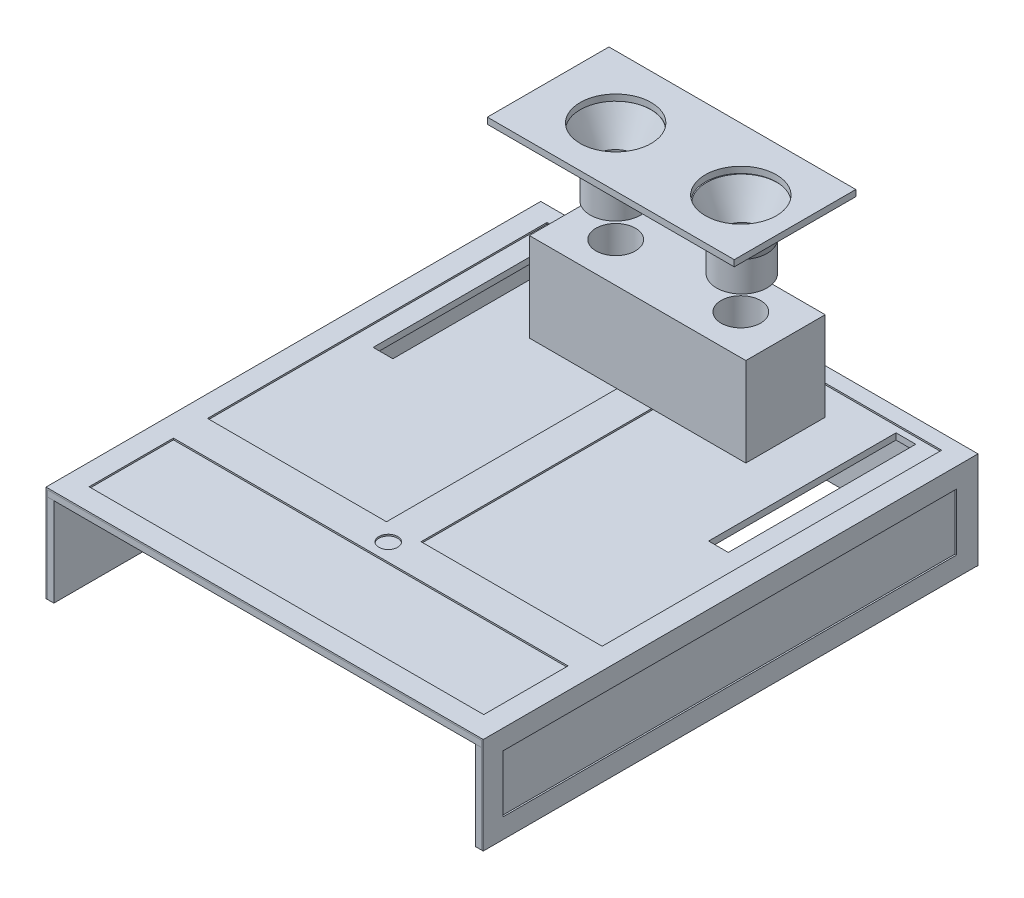
from build123d import *

# Parameters (mm, degrees)
SKETCH2_W            = 10
SKETCH2_H            = 95
BOSS_EXTRUDE1_DEPTH  = 3.175
BOSS_EXTRUDE2_DEPTH  = 3.175
SKETCH6_W            = 220
SKETCH6_H            = 250
SKETCH6_R            = 4.757017435
SKETCH6_W_2          = 200
SKETCH6_H_2          = 42.736820738
SKETCH6_W_3          = 90.723680888
SKETCH6_H_3          = 172.072273937
SKETCH6_W_4          = 91.778190592
BOSS_EXTRUDE5_DEPTH  = 0.8
SKETCH9_W            = 249.946143141
SKETCH9_H            = 48.975
SKETCH9_W_2          = 229.946143141
SKETCH9_H_2          = 28.975
BOSS_EXTRUDE7_DEPTH  = 0.8
SKETCH10_W           = 109.697281068
SKETCH10_H           = 40.228121307
BOSS_EXTRUDE8_DEPTH  = 45
SKETCH11_R           = 10
CUT_EXTRUDE1_DEPTH   = 30
SKETCH12_R           = 3.414901982
BOSS_EXTRUDE9_DEPTH  = 93
SKETCH13_W           = 125.125550564
SKETCH13_H           = 61.612798217
SKETCH13_R           = 18
BOSS_EXTRUDE10_DEPTH = 3.175
SKETCH16_R           = 12.813177074
SKETCH16_R_2         = 10.264351108
BOSS_EXTRUDE11_DEPTH = 15.175
SKETCH17_W           = 221.6
SKETCH17_H           = 49.134485582
BOSS_EXTRUDE12_DEPTH = 0.8


with BuildPart() as part:
    # Sketch2 → Boss-Extrude1 (new body)
    with BuildSketch(Plane(origin=(0, 0, 0), x_dir=(1, 0, 0), z_dir=(0, 1, 0))):
        Polygon((-162.266187111, -88.214102909), (57.733812889, -88.214102909), (57.733812889, -68.214102909), (54.558812889, -68.214102909), (54.558812889, -48.214102909), (57.733812889, -48.214102909), (57.733812889, -28.214102909), (54.558812889, -28.214102909), (54.558812889, -8.214102909), (57.733812889, -8.214102909), (57.733812889, 11.785897091), (54.558812889, 11.785897091), (54.558812889, 31.785897091), (57.733812889, 31.785897091), (57.733812889, 51.785897091), (54.558812889, 51.785897091), (54.558812889, 71.785897091), (57.733812889, 71.785897091), (57.733812889, 91.785897091), (54.558812889, 91.785897091), (54.558812889, 111.785897091), (57.733812889, 111.785897091), (57.733812889, 131.785897091), (54.558812889, 131.785897091), (54.558812889, 151.785897091), (57.733812889, 151.785897091), (57.733812889, 161.785897091), (-162.266187111, 161.785897091), (-162.266187111, 151.785897091), (-159.091187111, 151.785897091), (-159.091187111, 131.785897091), (-162.266187111, 131.785897091), (-162.266187111, 111.785897091), (-159.091187111, 111.785897091), (-159.091187111, 91.785897091), (-162.266187111, 91.785897091), (-162.266187111, 71.785897091), (-159.091187111, 71.785897091), (-159.091187111, 51.785897091), (-162.266187111, 51.785897091), (-162.266187111, 31.785897091), (-159.091187111, 31.785897091), (-159.091187111, 11.785897091), (-162.266187111, 11.785897091), (-162.266187111, -8.214102909), (-159.091187111, -8.214102909), (-159.091187111, -28.214102909), (-162.266187111, -28.214102909), (-162.266187111, -48.214102909), (-159.091187111, -48.214102909), (-159.091187111, -68.214102909), (-162.266187111, -68.214102909), align=None)
        with Locations((32.733812889, 104.285897091)):
            Rectangle(SKETCH2_W, SKETCH2_H, mode=Mode.SUBTRACT)
        with Locations((-137.266187111, 104.285897091)):
            Rectangle(SKETCH2_W, SKETCH2_H, mode=Mode.SUBTRACT)
    extrude(amount=BOSS_EXTRUDE1_DEPTH)


with BuildPart() as body_2:
    # Sketch3 → Boss-Extrude2 (new body)
    with BuildSketch(Plane.ZY.offset(159.091187111)):
        Polygon((68.214102909, 3.175), (68.214102909, 0), (88.214102909, 0), (88.214102909, -45), (-161.732040232, -45), (-161.732040232, 0), (-151.785897091, 0), (-151.785897091, 3.175), (-131.785897091, 3.175), (-131.785897091, 0), (-111.785897091, 0), (-111.785897091, 3.175), (-91.785897091, 3.175), (-91.785897091, 0), (-71.785897091, 0), (-71.785897091, 3.175), (-51.785897091, 3.175), (-51.785897091, 0), (-31.785897091, 0), (-31.785897091, 3.175), (-11.785897091, 3.175), (-11.785897091, 0), (8.214102909, 0), (8.214102909, 3.175), (28.214102909, 3.175), (28.214102909, 0), (48.214102909, 0), (48.214102909, 3.175), align=None)
    extrude(amount=BOSS_EXTRUDE2_DEPTH)


with BuildPart() as body_3:
    # Sketch6 → Boss-Extrude5 (new body)
    with BuildSketch(Plane(origin=(0, 3.175, 0), x_dir=(1, 0, 0), z_dir=(0, 1, 0))):
        with Locations((-52.266187111, 36.785897091)):
            Rectangle(SKETCH6_W, SKETCH6_H)
        with Locations((-52.266187111, -25.538376938)):
            Circle(SKETCH6_R, mode=Mode.SUBTRACT)
        with Locations((-52.266187111, -55.794020292)):
            Rectangle(SKETCH6_W_2, SKETCH6_H_2, mode=Mode.SUBTRACT)
        with Locations((-106.904346667, 68.87270147)):
            Rectangle(SKETCH6_W_3, SKETCH6_H_3, mode=Mode.SUBTRACT)
        with Locations((1.844717593, 68.87270147)):
            Rectangle(SKETCH6_W_4, SKETCH6_H_3, mode=Mode.SUBTRACT)
    extrude(amount=BOSS_EXTRUDE5_DEPTH)

    # Sketch9 → Boss-Extrude7 (add)
    with BuildSketch(Plane.ZY.offset(162.266187111)):
        with Locations((-36.758968661, -20.5125)):
            Rectangle(SKETCH9_W, SKETCH9_H)
        with Locations((-36.758968661, -20.5125)):
            Rectangle(SKETCH9_W_2, SKETCH9_H_2, mode=Mode.SUBTRACT)
    boss_extrude7 = extrude(amount=BOSS_EXTRUDE7_DEPTH)

    # Mirror5: Boss-Extrude7 across plane
    add(boss_extrude7.mirror(Plane.ZY.offset(52.266187111)))

    # Sketch17 → Boss-Extrude12 (add)
    with BuildSketch(Plane(origin=(0, 0, -161.732040232), x_dir=(-1, 0, 0), z_dir=(0, 0, -1))):
        with Locations((52.266187111, -20.592242791)):
            Rectangle(SKETCH17_W, SKETCH17_H)
    extrude(amount=BOSS_EXTRUDE12_DEPTH)


with BuildPart() as body_4:
    # Sketch10 → Boss-Extrude8 (new body)
    with BuildSketch(Plane(origin=(0, 3.975, 0), x_dir=(1, 0, 0), z_dir=(0, 1, 0))):
        with Locations((-51.104751529, 119.775749139)):
            Rectangle(SKETCH10_W, SKETCH10_H)
    extrude(amount=BOSS_EXTRUDE8_DEPTH)

    # Sketch11 → Cut-Extrude1 (cut)
    with BuildSketch(Plane(origin=(0, 48.975, 0), x_dir=(1, 0, 0), z_dir=(0, 1, 0))):
        with Locations((-82.332653929, 119.775749139)):
            Circle(SKETCH11_R)
        with Locations((-18.909790917, 119.775749139)):
            Circle(SKETCH11_R)
    extrude(amount=-CUT_EXTRUDE1_DEPTH, mode=Mode.SUBTRACT)


with BuildPart() as body_5:
    # Sketch12 → Boss-Extrude9 (new body)
    with BuildSketch(Plane(origin=(0, 3.975, 0), x_dir=(1, 0, 0), z_dir=(0, 1, 0))):
        with Locations((-113.317828916, 147.399324115)):
            Circle(SKETCH12_R)
    extrude(amount=BOSS_EXTRUDE9_DEPTH)

    # Sketch13 → Boss-Extrude10 (add)
    with BuildSketch(Plane(origin=(0, 96.975, 0), x_dir=(1, 0, 0), z_dir=(0, 1, 0))):
        with Locations((-54.859424633, 120.633304207)):
            Rectangle(SKETCH13_W, SKETCH13_H)
        with Locations((-82.332653929, 119.775749139)):
            Circle(SKETCH13_R, mode=Mode.SUBTRACT)
        with Locations((-18.909790917, 119.775749139)):
            Circle(SKETCH13_R, mode=Mode.SUBTRACT)
    extrude(amount=BOSS_EXTRUDE10_DEPTH)

    # Sketch14 → Revolve1 (revolve)
    with BuildSketch(Plane(origin=(-82.422199915, 0, 0), x_dir=(0, 0, -1), z_dir=(1, 0, 0))):
        Polygon((101.834041847, 96.975), (109.625498003, 81.251522407), (106.962572065, 81.251522407), (99.342946609, 96.975), align=None)
    revolve1 = revolve(axis=Axis((-82.422199915, 48.975, -119.775749139), (0, 1, 0)))

    # Sketch16 → Boss-Extrude11 (add)
    with BuildSketch(Plane.XZ.offset(-81.251522407)):
        with Locations((-82.422199915, -119.775749139)):
            Circle(SKETCH16_R)
        with Locations((-82.422199915, -119.775749139)):
            Circle(SKETCH16_R_2, mode=Mode.SUBTRACT)
    boss_extrude11 = extrude(amount=BOSS_EXTRUDE11_DEPTH)

    # Mirror2: Revolve1, Boss-Extrude11 across plane
    add(revolve1.mirror(Plane.ZY.offset(50.422199915)))
    add(boss_extrude11.mirror(Plane.ZY.offset(50.422199915)))


with BuildPart() as body_6:
    # Mirror4: mirrored copy
    add(body_2.part.mirror(Plane.ZY.offset(52.266187111)))


solid = Compound([part.part, body_2.part, body_3.part, body_4.part, body_5.part, body_6.part])
